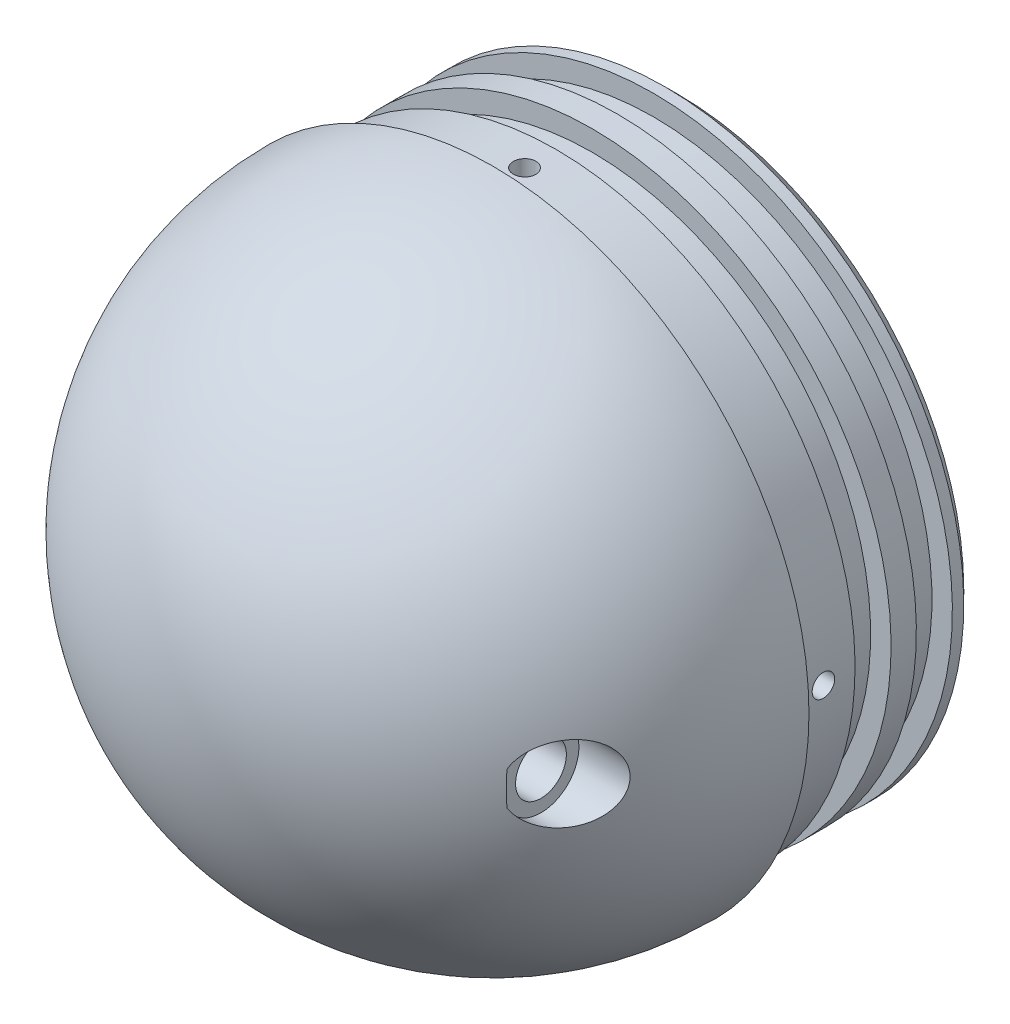
from build123d import *

# Parameters (mm, degrees)
F_4_40_TAPPED_HOLE1_D               = 2.2606
F_4_40_TAPPED_HOLE1_DEPTH           = 7.62
F_4_40_TAPPED_HOLE1_TIP             = 0.679152758
F_4_40_TAPPED_HOLE1_ON_FACE_2_D     = 2.2606
F_4_40_TAPPED_HOLE1_ON_FACE_2_DEPTH = 7.62
F_4_40_TAPPED_HOLE1_ON_FACE_2_TIP   = 0.679152758
F_4_40_TAPPED_HOLE1_ON_FACE_3_D     = 2.2606
F_4_40_TAPPED_HOLE1_ON_FACE_3_DEPTH = 7.62
F_4_40_TAPPED_HOLE1_ON_FACE_3_TIP   = 0.679152758
F_4_40_TAPPED_HOLE1_ON_FACE_4_D     = 2.2606
F_4_40_TAPPED_HOLE1_ON_FACE_4_DEPTH = 7.62
F_4_40_TAPPED_HOLE1_ON_FACE_4_TIP   = 0.679152758
SKETCH10_R                          = 20.50415
CUT_EXTRUDE3_DEPTH                  = 31.75
F_4_40_TAPPED_HOLE2_D               = 2.2606
F_4_40_TAPPED_HOLE2_DEPTH           = 7.62
F_4_40_TAPPED_HOLE2_TIP             = 0.679152758
CHAMFER1_SIZE                       = 1.27
SCALE1_SCALE                        = 2.362204724


# Read off the part's stored shape, not the designer's step: AdvancedHole3
with BuildPart() as part:
    # Sketch2 → Revolve1 (revolve)
    with BuildSketch(Plane(origin=(0, 0, 0), x_dir=(0, 0, -1), z_dir=(1, 0, 0))):
        Polygon((-18.542, 30.02915), (-12.192, 30.02915), (-12.192, 27.9781), (-8.5725, 27.9781), (-8.5725, 30.02915), (-6.0325, 30.02915), (-6.0325, 27.9781), (-2.413, 27.9781), (-2.413, 30.02915), (0, 30.02915), (0, 0), (-18.542, 0), align=None)
    revolve(axis=Axis((0, 0, 0), (0, 0, 1)))

    # #4-40 Tapped Hole1
    with Locations(Plane(origin=(0, -30.02915, 15.367), x_dir=(0, 0, -1), z_dir=(0, -1, 0))):
        with Locations((0, 0)):
            Hole(F_4_40_TAPPED_HOLE1_D / 2, depth=F_4_40_TAPPED_HOLE1_DEPTH)
            with Locations((0, 0, -(F_4_40_TAPPED_HOLE1_DEPTH + F_4_40_TAPPED_HOLE1_TIP / 2))):  # 118° drill point
                Cone(0, F_4_40_TAPPED_HOLE1_D / 2, F_4_40_TAPPED_HOLE1_TIP, mode=Mode.SUBTRACT)

    # #4-40 Tapped Hole1 on face 2
    with Locations(Plane(origin=(30.02915, 0, 15.367), x_dir=(0, 0, 1), z_dir=(1, 0, 0))):
        with Locations((0, 0)):
            Hole(F_4_40_TAPPED_HOLE1_ON_FACE_2_D / 2, depth=F_4_40_TAPPED_HOLE1_ON_FACE_2_DEPTH)
            with Locations((0, 0, -(F_4_40_TAPPED_HOLE1_ON_FACE_2_DEPTH + F_4_40_TAPPED_HOLE1_ON_FACE_2_TIP / 2))):  # 118° drill point
                Cone(0, F_4_40_TAPPED_HOLE1_ON_FACE_2_D / 2, F_4_40_TAPPED_HOLE1_ON_FACE_2_TIP, mode=Mode.SUBTRACT)

    # #4-40 Tapped Hole1 on face 3
    with Locations(Plane(origin=(-30.02915, 0, 15.367), x_dir=(0, 0, -1), z_dir=(-1, 0, 0))):
        with Locations((0, 0)):
            Hole(F_4_40_TAPPED_HOLE1_ON_FACE_3_D / 2, depth=F_4_40_TAPPED_HOLE1_ON_FACE_3_DEPTH)
            with Locations((0, 0, -(F_4_40_TAPPED_HOLE1_ON_FACE_3_DEPTH + F_4_40_TAPPED_HOLE1_ON_FACE_3_TIP / 2))):  # 118° drill point
                Cone(0, F_4_40_TAPPED_HOLE1_ON_FACE_3_D / 2, F_4_40_TAPPED_HOLE1_ON_FACE_3_TIP, mode=Mode.SUBTRACT)

    # #4-40 Tapped Hole1 on face 4
    with Locations(Plane(origin=(0, 30.02915, 15.367), x_dir=(0, 0, 1), z_dir=(0, 1, 0))):
        with Locations((0, 0)):
            Hole(F_4_40_TAPPED_HOLE1_ON_FACE_4_D / 2, depth=F_4_40_TAPPED_HOLE1_ON_FACE_4_DEPTH)
            with Locations((0, 0, -(F_4_40_TAPPED_HOLE1_ON_FACE_4_DEPTH + F_4_40_TAPPED_HOLE1_ON_FACE_4_TIP / 2))):  # 118° drill point
                Cone(0, F_4_40_TAPPED_HOLE1_ON_FACE_4_D / 2, F_4_40_TAPPED_HOLE1_ON_FACE_4_TIP, mode=Mode.SUBTRACT)

    # Sketch6 → Revolve2 (revolve)
    with BuildSketch(Plane(origin=(0, 0, 0), x_dir=(1, 0, 0), z_dir=(0, 1, 0)), mode=Mode.PRIVATE) as revolve2_sk:
        with BuildLine():
            Line((0, -18.542), (31.75, -18.542))
            ThreePointArc((31.75, -18.542), (22.450640303, -40.992640303), (0, -50.292))
            Line((0, -50.292), (0, -18.542))
        make_face()
    revolve(revolve2_sk.sketch.rotate(Axis((0, 0, 18.542), (0, 0, 1)), 90), axis=Axis((0, 0, 18.542), (0, 0, 1)))

    # Sketch10 → Cut-Extrude3 (cut)
    with BuildSketch(Plane(origin=(0, 0, 0), x_dir=(-1, 0, 0), z_dir=(0, 0, -1))):
        with Locations(Location((0, 0, 0), (0, 0, 90))):
            Circle(SKETCH10_R)
    extrude(amount=-CUT_EXTRUDE3_DEPTH, mode=Mode.SUBTRACT)

    # #4-40 Tapped Hole2
    with Locations(Plane(origin=(0, 0, 31.75), x_dir=(-1, 0, 0), z_dir=(0, 0, -1))):
        with Locations((0, 0)):
            Hole(F_4_40_TAPPED_HOLE2_D / 2, depth=F_4_40_TAPPED_HOLE2_DEPTH)
            with Locations((0, 0, -(F_4_40_TAPPED_HOLE2_DEPTH + F_4_40_TAPPED_HOLE2_TIP / 2))):  # 118° drill point
                Cone(0, F_4_40_TAPPED_HOLE2_D / 2, F_4_40_TAPPED_HOLE2_TIP, mode=Mode.SUBTRACT)

    # Chamfer1
    chamfer1_edges = [part.edges().sort_by_distance(p)[0] for p in [
        (0, -30.02915, 0),
    ]]
    chamfer(chamfer1_edges, length=CHAMFER1_SIZE)

    # AdvancedHole3 outline → AdvancedHole3 (revolve, cut)
    with BuildSketch(Plane.YX.offset(-36.83)):
        Polygon((3.81, 28.256858344), (0, 28.256858344), (0, 8.880183098), (2.5527, 10.414), (2.5527, 23.114), (3.81, 23.114), align=None)
    advancedhole3 = revolve(axis=Axis((0, 0, 36.83), (1, 0, 0)), mode=Mode.SUBTRACT)

    # Mirror2: AdvancedHole3 across plane
    add(advancedhole3.mirror(Plane(origin=(0, 0, 0), x_dir=(0, 0, 1), z_dir=(1, 0, 0))), mode=Mode.SUBTRACT)


with BuildPart() as part_1:
    # Scale1: scaled about (-5.1967e-05, 4.9002e-05, 24.526771352)
    add(part.part.scale(SCALE1_SCALE).moved(Location((7.079e-05, -6.6751e-05, -33.41048381))))


solid = part_1.part
